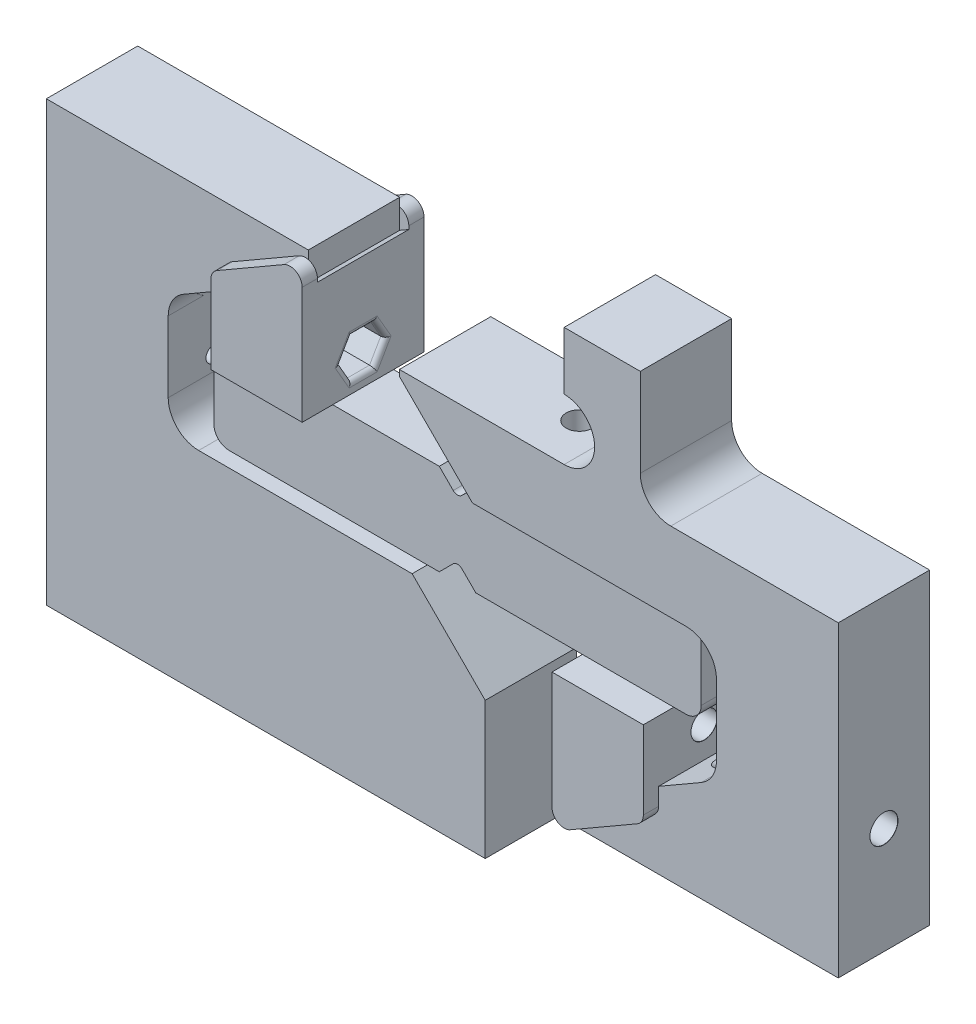
from build123d import *

# Parameters (mm, degrees)
BOSS_EXTRUDE1_DEPTH                      = 6.35
MIRROR1_AT_THE_SECOND_PLANE_COPY_1_DEPTH = 6.35
FILLET1_R                                = 1.27
FILLET2_R                                = 3.175
BOSS_EXTRUDE2_DEPTH                      = 9.525
BOSS_EXTRUDE3_DEPTH                      = 12.7
BOSS_EXTRUDE6_START                      = -12.7
BOSS_EXTRUDE6_DEPTH                      = 3.175
FILLET4_R                                = 2.54
CUT_EXTRUDE1_START                       = 26.035
CUT_EXTRUDE1_DEPTH                       = 10
SKETCH32_R                               = 4.7625
CUT_EXTRUDE3_DEPTH                       = 57.15
BOSS_EXTRUDE7_START                      = -6.35
BOSS_EXTRUDE7_DEPTH                      = 3.175
FILLET5_R                                = 1
MIRROR2_ANGLE                            = 180
MIRROR2_2_ANGLE                          = 180
BOSS_EXTRUDE4_START                      = 9.525
BOSS_EXTRUDE4_DEPTH                      = 19.05
FILLET3_R                                = 6.35
BOSS_EXTRUDE5_START                      = -9.525
SKETCH11_W                               = 91.497211864
SKETCH11_H                               = 27.305
BOSS_EXTRUDE5_DEPTH                      = 19.05
SKETCH31_W                               = 1.65
SKETCH31_H                               = 165.1


with BuildPart() as part:
    # Sketch1 → Boss-Extrude1 (new, symmetric)
    with BuildSketch(Plane.XY):
        Polygon((0, 0), (0, 5.715), (3.81, 9.525), (50.8, 9.525), (50.8, 0), align=None)
    boss_extrude1 = extrude(amount=BOSS_EXTRUDE1_DEPTH, both=True)



with BuildPart() as mirror1_1:
    # Mirror1: Boss-Extrude1 across plane
    add(boss_extrude1.mirror(Plane(origin=(0, 0, 0), x_dir=(0, 0, 1), z_dir=(1, 0, 0))))


with BuildPart() as part_1:
    add(part.part)

    add(mirror1_1.part)  # Mirror1 at the second plane merges Mirror1_1
    # Mirror1 at the second plane: Boss-Extrude1 across plane
    add(boss_extrude1.mirror(Plane.ZX))

    # Mirror1 at the second plane copy 1 sketc → Mirror1 at the second plane copy 1 (add, symmetric)
    with BuildSketch(Plane(origin=(0, 0, 0), x_dir=(-1, 0, 0), z_dir=(0, 0, 1))):
        Polygon((0, 0), (0, 5.715), (3.81, 9.525), (50.8, 9.525), (50.8, 0), align=None)
    extrude(amount=MIRROR1_AT_THE_SECOND_PLANE_COPY_1_DEPTH, both=True)

    # Fillet1
    fillet1_edges = [part_1.edges().sort_by_distance(p)[0] for p in [
        (0, -5.715, 0),
        (0, 5.715, 0),
    ]]
    fillet(fillet1_edges, radius=FILLET1_R)

    # Fillet2
    fillet2_edges = [part_1.edges().sort_by_distance(p)[0] for p in [
        (50.8, -9.525, 0),
        (-50.8, 9.525, 0),
        (-50.8, -9.525, 0),
        (50.8, 9.525, 0),
    ]]
    fillet(fillet2_edges, radius=FILLET2_R)


with BuildPart() as body_2:
    # Sketch2 → Boss-Extrude2 (new, symmetric)
    with BuildSketch(Plane.XY):
        with BuildLine():
            Line((6.292788136, 9.525), (50.8, 9.525))
            ThreePointArc((50.8, 9.525), (55.290128061, 7.665128061), (57.15, 3.175))
            Line((57.15, 3.175), (57.15, -11.593094793))
            ThreePointArc((57.15, -11.593094793), (56.299261314, -14.768094793), (53.975, -17.092356107))
            Line((53.975, -17.092356107), (27.94, -32.123670365))
            Line((27.94, -32.123670365), (27.94, -38.1))
            Line((27.94, -38.1), (82.55, -38.1))
            Line((82.55, -38.1), (82.55, 26.035))
            Line((82.55, 26.035), (-8.947211864, 26.035))
            Line((-8.947211864, 26.035), (-8.947211864, 24.765))
            Line((-8.947211864, 24.765), (6.292788136, 9.525))
        make_face()
    extrude(amount=BOSS_EXTRUDE2_DEPTH, both=True)

    # Sketch8 → M5 Clearance Hole2 (revolve, cut)
    with BuildSketch(Plane(origin=(82.55, -15.875, 0), x_dir=(0, 0, -1), z_dir=(0, 1, 0))):
        Polygon((0, 0), (0, 133.35), (2.9, 133.35), (2.9, 0.025), (2.925, 0), align=None)
    revolve(axis=Axis((88.9, -15.875, 0), (-1, 0, 0)), mode=Mode.SUBTRACT)

    # Sketch32 → Cut-Extrude3 (cut)
    with BuildSketch(Plane(origin=(0, 0, 0), x_dir=(0, 0, -1), z_dir=(1, 0, 0))):
        with Locations((0, -15.875)):
            Circle(SKETCH32_R)
    extrude(amount=CUT_EXTRUDE3_DEPTH, mode=Mode.SUBTRACT)

    # Sketch34 → Boss-Extrude7 (add)
    with BuildSketch(Plane.XY.offset(BOSS_EXTRUDE7_START)):
        with BuildLine():
            Line((6.292788136, 9.525), (8.832788136, 6.985))
            Line((8.832788136, 6.985), (50.8, 6.985))
            ThreePointArc((50.8, 6.985), (55.290128061, 5.125128061), (57.15, 0.635))
            Line((57.15, 0.635), (57.15, 3.175))
            ThreePointArc((57.15, 3.175), (55.290128061, 7.665128061), (50.8, 9.525))
            Line((50.8, 9.525), (6.292788136, 9.525))
        make_face()
    extrude(amount=-BOSS_EXTRUDE7_DEPTH)


with BuildPart() as body_3:
    # Sketch2<4> → Boss-Extrude3 (new, symmetric)
    with BuildSketch(Plane.XY):
        Polygon((26.035, -33.223522628), (45.085, -22.225), (45.085, -9.525), (26.035, -9.525), align=None)
    extrude(amount=BOSS_EXTRUDE3_DEPTH, both=True)

    # Sketch6 → M5 Clearance Hole1 (revolve, cut)
    with BuildSketch(Plane(origin=(45.085, -15.875, 0), x_dir=(0, 0, -1), z_dir=(0, 1, 0))):
        Polygon((0, 0), (0, 95.885), (2.75, 95.885), (2.75, 0.025), (2.775, 0), align=None)
    revolve(axis=Axis((51.435, -15.875, 0), (-1, 0, 0)), mode=Mode.SUBTRACT)

    # Boss-Extrude6: read off the stored shape, not the designer's step
    # Boss-Extrude6 outline → Boss-Extrude6 (add)
    with BuildSketch(Plane.XY.offset(BOSS_EXTRUDE6_START)):
        Polygon((26.035, -33.223522628), (26.035, -38.303522628), (45.085, -27.305), (45.085, -22.225), align=None)
    boss_extrude6 = extrude(amount=BOSS_EXTRUDE6_DEPTH)

    # Mirror3: Boss-Extrude6 across plane
    add(boss_extrude6.mirror(Plane.XY))

    # Fillet4
    fillet4_edges = [body_3.edges().sort_by_distance(p)[0] for p in [
        (45.085, -27.305, -11.1125),
        (26.035, -38.303522628, -11.1125),
        (26.035, -38.303522628, 11.1125),
        (45.085, -27.305, 11.1125),
    ]]
    fillet(fillet4_edges, radius=FILLET4_R)

    # Sketch27 → Cut-Extrude1 (cut)
    with BuildSketch(Plane(origin=(0, 0, 0), x_dir=(0, 0, -1), z_dir=(1, 0, 0)).offset(CUT_EXTRUDE1_START)):
        Polygon((2.33826859, -19.925), (4.67653718, -15.875), (2.33826859, -11.825), (-2.33826859, -11.825), (-4.67653718, -15.875), (-2.33826859, -19.925), align=None)
    extrude(amount=CUT_EXTRUDE1_DEPTH, mode=Mode.SUBTRACT)

    # Fillet5
    fillet5_edges = [body_3.edges().sort_by_distance(p)[0] for p in [
        (26.035, -13.85, 3.507402885),
        (26.035, -11.825, 0),
        (26.035, -13.85, -3.507402885),
        (26.035, -17.9, -3.507402885),
        (26.035, -19.925, 0),
        (26.035, -17.9, 3.507402885),
    ]]
    fillet(fillet5_edges, radius=FILLET5_R)


with BuildPart() as body_4:
    # Mirror2: read off the stored shape, not the designer's step
    # Mirror2: copy of body 3
    add(body_3.part.rotate(Axis((0, 0, 0), (0, 0, 1)), MIRROR2_ANGLE))


with BuildPart() as body_5:
    # Mirror2 2: copy of body 2
    add(body_2.part.rotate(Axis((0, 0, 0), (0, 0, 1)), MIRROR2_2_ANGLE))

    # Sketch11 → Boss-Extrude5 (add)
    with BuildSketch(Plane.XY.offset(BOSS_EXTRUDE5_START)):
        with Locations((-36.801394068, -39.6875)):
            Rectangle(SKETCH11_W, SKETCH11_H)
    extrude(amount=BOSS_EXTRUDE5_DEPTH)

    # Sketch13 → M5x0.8 Tapped Hole3 (revolve, cut)
    with BuildSketch(Plane(origin=(-50.8, -53.34, 0), x_dir=(0, 0, -1), z_dir=(1, 0, 0))):
        Polygon((0, 0), (0, 13.4538073), (2.1, 12.192), (2.1, 0.425), (2.525, 0), align=None)
    revolve(axis=Axis((-50.8, -59.69, 0), (0, 1, 0)), mode=Mode.SUBTRACT)

    # Sketch31 → M4x0.7 Tapped Hole1 (revolve, cut)
    with BuildSketch(Plane(origin=(-82.55, 0, 0), x_dir=(0, 0, 1), z_dir=(0, 1, 0))):
        with Locations((0.825, 82.55)):
            Rectangle(SKETCH31_W, SKETCH31_H)
    revolve(axis=Axis((-88.9, 0, 0), (1, 0, 0)), mode=Mode.SUBTRACT)


with BuildPart() as body_6:
    # Mirror2 3: mirrored copy
    add(body_3.part.mirror(Plane(origin=(0, 0, 0), x_dir=(1, 0, 0), z_dir=(0, 1, 0))))


with BuildPart() as body_7:
    # Mirror2 4: mirrored copy
    add(body_3.part.mirror(Plane.YZ))


with BuildPart() as body_8:
    # Mirror2 5: mirrored copy
    add(body_2.part.mirror(Plane(origin=(0, 0, 0), x_dir=(1, 0, 0), z_dir=(0, 1, 0))))


with BuildPart() as body_9:
    # Mirror2 6: mirrored copy
    add(body_2.part.mirror(Plane.YZ))


with BuildPart() as body_2_1:
    add(body_2.part)

    # Sketch9 → Boss-Extrude4 (add)
    with BuildSketch(Plane.XY.offset(BOSS_EXTRUDE4_START)):
        with BuildLine():
            Line((25.4, 26.035), (41.275, 26.035))
            Line((41.275, 26.035), (41.275, 50.8))
            Line((41.275, 50.8), (25.4, 50.8))
            Line((25.4, 50.8), (25.4, 38.735))
            ThreePointArc((25.4, 38.735), (31.75, 32.385), (25.4, 26.035))
        make_face()
    extrude(amount=-BOSS_EXTRUDE4_DEPTH)

    # Fillet3
    fillet3_edges = [body_2_1.edges().sort_by_distance(p)[0] for p in [
        (41.275, 26.035, 0),
    ]]
    fillet(fillet3_edges, radius=FILLET3_R)

    # Sketch25 → CBORE for M5 SHCS1 (revolve, cut)
    with BuildSketch(Plane(origin=(19.05, 9.525, 0), x_dir=(0, 0, -1), z_dir=(1, 0, 0))):
        Polygon((0, 0), (0, 41.275), (2.75, 41.275), (2.75, 5), (5, 5), (5, 0.025), (5.025, 0), align=None)
    revolve(axis=Axis((19.05, 3.175, 0), (0, 1, 0)), mode=Mode.SUBTRACT)


solid = Compound([part_1.part, body_3.part, body_4.part, body_5.part, body_2_1.part])
